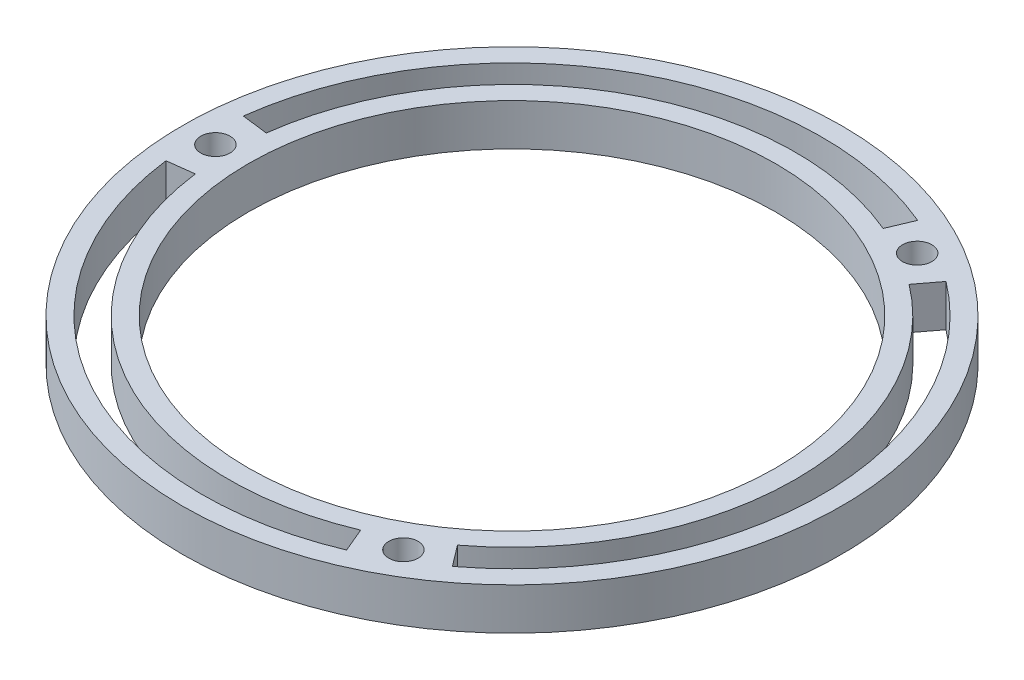
from build123d import *

# Parameters (mm, degrees)
SKETCH1_R           = 50
SKETCH1_R_2         = 40
BOSS_EXTRUDE1_DEPTH = 6.35
M3_HOLES_REACH      = 72.995
SKETCH2_R           = 2.225


with BuildPart() as part:
    # Sketch1 → Boss-Extrude1 (new body)
    with BuildSketch(Plane(origin=(0, 0, 0), x_dir=(1, 0, 0), z_dir=(0, 1, 0))):
        Circle(SKETCH1_R)
        with BuildLine():
            Line((28.403582676, -37.446448312), (25.986256491, -34.259516541))
            ThreePointArc((25.986256491, -34.259516541), (43, 0), (25.986256491, 34.259516541))
            Line((25.986256491, 34.259516541), (28.403582676, 37.446448312))
            ThreePointArc((28.403582676, 37.446448312), (47, 0), (28.403582676, -37.446448312))
        make_face(mode=Mode.SUBTRACT)
        with BuildLine():
            ThreePointArc((18.227784182, -43.321448312), (-23.5, -40.703193978), (-46.631366858, -5.875))
            Line((-46.631366858, -5.875), (-42.662739891, -5.375))
            ThreePointArc((-42.662739891, -5.375), (-21.5, -37.239092363), (16.6764834, -39.634516541))
            Line((16.6764834, -39.634516541), (18.227784182, -43.321448312))
        make_face(mode=Mode.SUBTRACT)
        with BuildLine():
            Line((18.227784182, 43.321448312), (16.6764834, 39.634516541))
            ThreePointArc((16.6764834, 39.634516541), (-21.5, 37.239092363), (-42.662739891, 5.375))
            Line((-42.662739891, 5.375), (-46.631366858, 5.875))
            ThreePointArc((-46.631366858, 5.875), (-23.5, 40.703193978), (18.227784182, 43.321448312))
        make_face(mode=Mode.SUBTRACT)
        Circle(SKETCH1_R_2, mode=Mode.SUBTRACT)
    extrude(amount=BOSS_EXTRUDE1_DEPTH)

    # Sketch2 → M3-holes (cut, up to next)
    with BuildSketch(Plane(origin=(0, 6.35, 0), x_dir=(1, 0, 0), z_dir=(0, 1, 0)), mode=Mode.PRIVATE) as m3_holes_sk1:
        with Locations((-45, 0)):
            Circle(SKETCH2_R)
    m3_holes_tool1 = extrude(m3_holes_sk1.sketch, amount=-M3_HOLES_REACH, mode=Mode.PRIVATE) & part.part
    # Sketch2 → M3-holes (cut, up to next)
    with BuildSketch(Plane(origin=(0, 6.35, 0), x_dir=(1, 0, 0), z_dir=(0, 1, 0)), mode=Mode.PRIVATE) as m3_holes_sk2:
        with Locations((22.5, -38.97114317)):
            Circle(SKETCH2_R)
    m3_holes_tool2 = extrude(m3_holes_sk2.sketch, amount=-M3_HOLES_REACH, mode=Mode.PRIVATE) & part.part
    # Sketch2 → M3-holes (cut, up to next)
    with BuildSketch(Plane(origin=(0, 6.35, 0), x_dir=(1, 0, 0), z_dir=(0, 1, 0)), mode=Mode.PRIVATE) as m3_holes_sk3:
        with Locations((22.5, 38.97114317)):
            Circle(SKETCH2_R)
    m3_holes_tool3 = extrude(m3_holes_sk3.sketch, amount=-M3_HOLES_REACH, mode=Mode.PRIVATE) & part.part
    add(m3_holes_tool1.solids().sort_by_distance((-45, 6.35, 0))[0], mode=Mode.SUBTRACT)
    add(m3_holes_tool2.solids().sort_by_distance((22.5, 6.35, 38.971143))[0], mode=Mode.SUBTRACT)
    add(m3_holes_tool3.solids().sort_by_distance((22.5, 6.35, -38.971143))[0], mode=Mode.SUBTRACT)


solid = part.part
